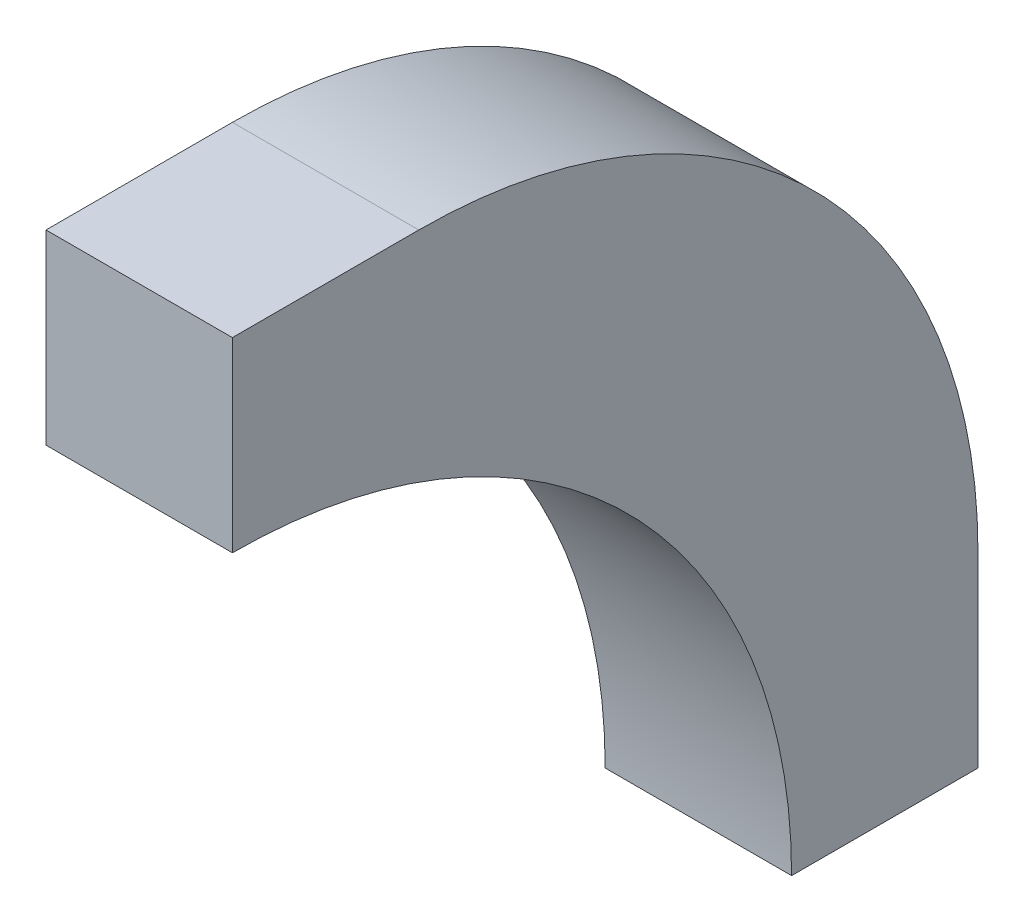
from build123d import *

# Parameters (mm, degrees)
BOSS_EXTRUDE1_DEPTH = 12.7
FILLET1_R           = 38.1
FILLET2_R           = 38.1


with BuildPart() as part:
    # Sketch1 → Boss-Extrude1 (new body)
    with BuildSketch(Plane(origin=(0, 0, 0), x_dir=(0, 0, -1), z_dir=(1, 0, 0))):
        Polygon((0, 0), (0, 50.8), (-50.8, 50.8), (-50.8, 38.1), (-12.7, 38.1), (-12.7, 0), align=None)
    extrude(amount=BOSS_EXTRUDE1_DEPTH)

    # Fillet1
    fillet1_edges = [part.edges().sort_by_distance(p)[0] for p in [
        (6.35, 38.1, 12.7),
    ]]
    fillet(fillet1_edges, radius=FILLET1_R - 0.0001)  # a hair under: the kernel refuses the full size

    # Fillet2
    fillet2_edges = [part.edges().sort_by_distance(p)[0] for p in [
        (6.35, 50.8, 0),
    ]]
    fillet(fillet2_edges, radius=FILLET2_R)


solid = part.part
